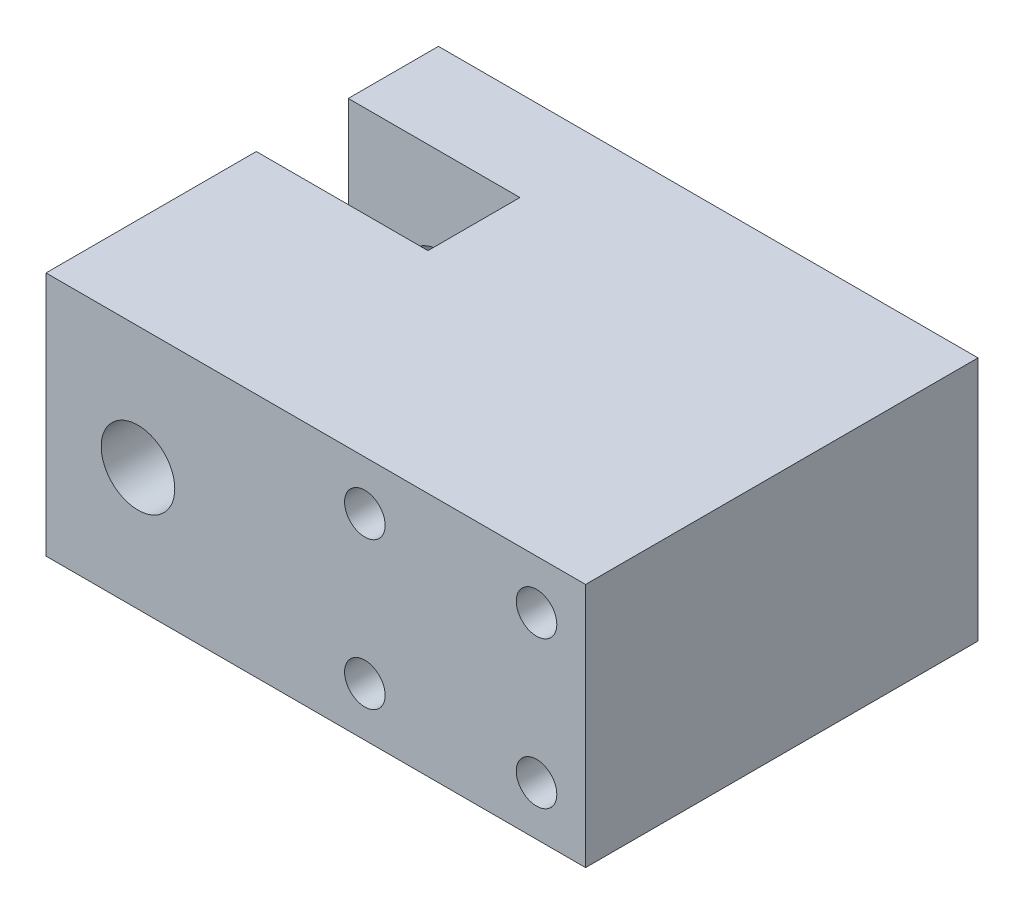
from build123d import *

# Parameters (mm, degrees)
SKETCH1_W                 = 55.88
SKETCH1_H                 = 40.64
BOSS_EXTRUDE1_DEPTH       = 25.4
SKETCH3_R                 = 3.81
CUT_EXTRUDE1_DEPTH        = 74.616193871
SKETCH4_W                 = 17.78
SKETCH4_H                 = 9.525
CUT_EXTRUDE2_DEPTH        = 74.616193871
M5X0_8_TAPPED_HOLE1_D     = 4.2
M5X0_8_TAPPED_HOLE1_DEPTH = 25.4
M5X0_8_TAPPED_HOLE1_TIP   = 1.2618073


with BuildPart() as part:
    # Sketch1 → Boss-Extrude1 (new body)
    with BuildSketch(Plane(origin=(0, 0, 0), x_dir=(1, 0, 0), z_dir=(0, 1, 0))):
        with Locations((27.94, 20.32)):
            Rectangle(SKETCH1_W, SKETCH1_H)
    extrude(amount=BOSS_EXTRUDE1_DEPTH)

    # Sketch3 → Cut-Extrude1 (cut, through all)
    with BuildSketch(Plane.XY):
        with Locations((9.525, 12.7)):
            Circle(SKETCH3_R)
    extrude(amount=-CUT_EXTRUDE1_DEPTH, mode=Mode.SUBTRACT)

    # Sketch4 → Cut-Extrude2 (cut, through all)
    with BuildSketch(Plane(origin=(0, 25.4, 0), x_dir=(1, 0, 0), z_dir=(0, 1, 0))):
        with Locations((8.89, 26.54)):
            Rectangle(SKETCH4_W, SKETCH4_H)
    extrude(amount=-CUT_EXTRUDE2_DEPTH, mode=Mode.SUBTRACT)

    # M5x0.8 Tapped Hole1
    with Locations(Plane.XY):
        with Locations((50.8, 5.08), (33.02, 5.08), (33.02, 20.32), (50.8, 20.32)):
            Hole(M5X0_8_TAPPED_HOLE1_D / 2, depth=M5X0_8_TAPPED_HOLE1_DEPTH)
            with Locations((0, 0, -(M5X0_8_TAPPED_HOLE1_DEPTH + M5X0_8_TAPPED_HOLE1_TIP / 2))):  # 118° drill point
                Cone(0, M5X0_8_TAPPED_HOLE1_D / 2, M5X0_8_TAPPED_HOLE1_TIP, mode=Mode.SUBTRACT)


solid = part.part
